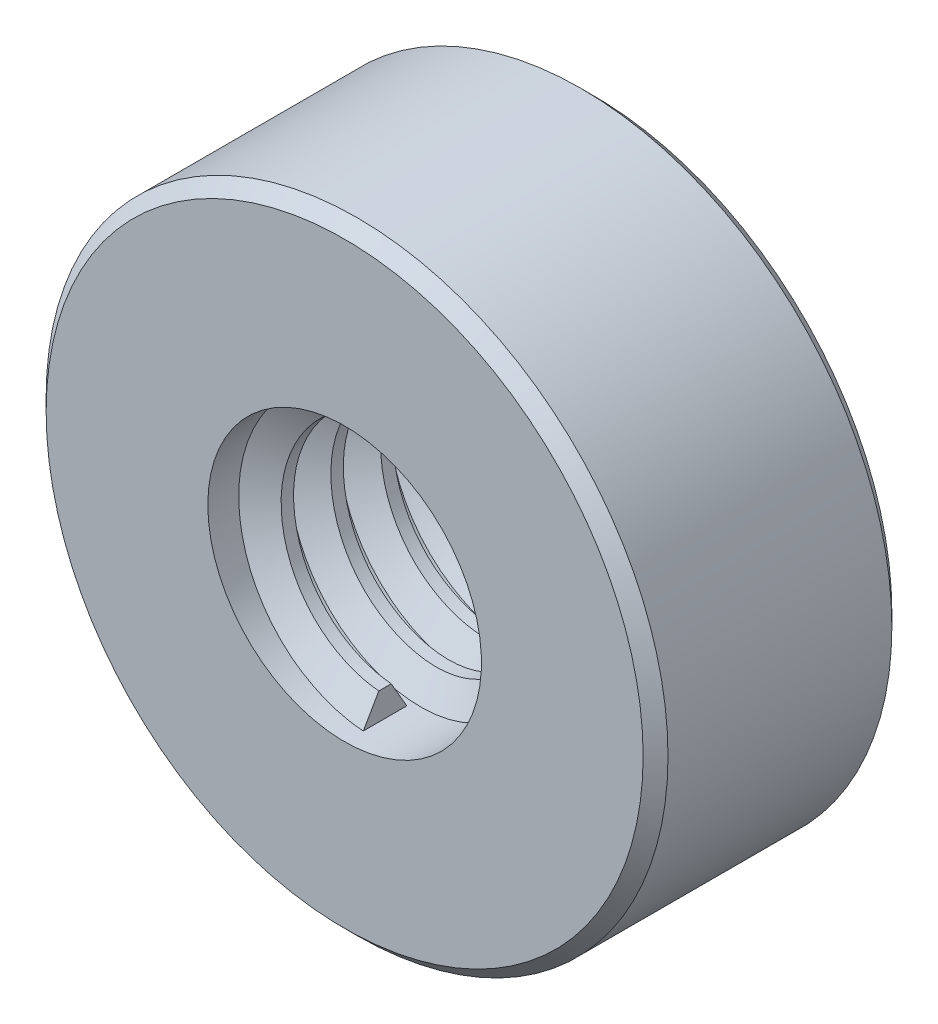
from build123d import *

# Parameters (mm, degrees)
SKETCH_1_R        = 2.5
EXTRUDE_1_DEPTH   = 2
CHAMFER_2_SIZE    = 0.1
HOLE_WIZARD_M21_D = 2.2
THREAD_1_PITCH    = 0.4
SCALE_1_SCALE     = 2


with BuildPart() as part:
    # Sketch 1 → Бобышка-Вытянуть1 (new body)
    with BuildSketch(Plane.XY):
        Circle(SKETCH_1_R)
    extrude(amount=EXTRUDE_1_DEPTH)

    # Фаска2
    chamfer_2_edges = [part.edges().sort_by_distance(p)[0] for p in [
        (-2.5, 0, 0),
        (-2.5, 0, 2),
    ]]
    chamfer(chamfer_2_edges, length=CHAMFER_2_SIZE)

    # Отверстие с зазором M21 (through all)
    with Locations(Plane(origin=(0, 0, 0), x_dir=(-1, 0, 0), z_dir=(0, 0, -1))):
        with Locations((0, 0)):
            Hole(HOLE_WIZARD_M21_D / 2)

    # Резьба1: the profile of Sketch 1 2 profile screwed along a right-hand helix of 3.75 turns, 6 arcs to a turn; built about Z, then put on its axis
    thread_1_z = Axis((0, 0, 0), (0, 0, 1))
    thread_1_corners = [(1.1003, 0, -0.000173205), (1.1003, 0, 0.350173204), (0.88349365, 0, 0.224999999), (0.88349365, 0, 0.124999999)]
    with BuildLine(mode=Mode.PRIVATE) as thread_1_profile:
        Line(thread_1_corners[0], thread_1_corners[1])
        Line(thread_1_corners[1], thread_1_corners[2])
        Line(thread_1_corners[2], thread_1_corners[3])
        Line(thread_1_corners[3], thread_1_corners[0])
    thread_1_cap = Face(thread_1_profile.wire())
    thread_1_turn_angles = [0, 30, 60, 90, 120, 150, 180, 210, 240, 270, 300, 330, 360]
    thread_1_turn_weights = [1, 0.8660254037844387, 1, 0.8660254037844387, 1, 0.8660254037844387, 1, 0.8660254037844387, 1, 0.8660254037844387, 1, 0.8660254037844387, 1]
    thread_1_turn_rails = [Edge.make_bspline([Vector(p[0], p[1], 0).rotate(thread_1_z, thread_1_turn_angles[k]) / thread_1_turn_weights[k] + Vector(0, 0, p[2] + THREAD_1_PITCH * thread_1_turn_angles[k] / 360) for k in range(13)], [0, 0, 0, 1, 1, 2, 2, 3, 3, 4, 4, 5, 5, 6, 6, 6], 2, thread_1_turn_weights) for p in thread_1_corners]
    thread_1_turn_sides = [Face.make_surface_from_curves(thread_1_turn_rails[p[0]], thread_1_turn_rails[p[1]]) for p in [(0, 1), (1, 2), (2, 3), (3, 0)]]
    thread_1_last_angles = [1080, 1110, 1140, 1170, 1200, 1230, 1260, 1290, 1320, 1335, 1350]
    thread_1_last_weights = [1, 0.8660254037844387, 1, 0.8660254037844387, 1, 0.8660254037844387, 1, 0.8660254037844387, 1, 0.9659258262890683, 1]
    thread_1_last_rails = [Edge.make_bspline([Vector(p[0], p[1], 0).rotate(thread_1_z, thread_1_last_angles[k]) / thread_1_last_weights[k] + Vector(0, 0, p[2] + THREAD_1_PITCH * thread_1_last_angles[k] / 360) for k in range(11)], [0, 0, 0, 1, 1, 2, 2, 3, 3, 4, 4, 5, 5, 5], 2, thread_1_last_weights) for p in thread_1_corners]
    thread_1_last_sides = [Face.make_surface_from_curves(thread_1_last_rails[p[0]], thread_1_last_rails[p[1]]) for p in [(0, 1), (1, 2), (2, 3), (3, 0)]]
    thread_1 = Plane(origin=(0, 0, 0), x_dir=(1, 0, 0), z_dir=(0, 0, 1)) * Solid(Shell([*[p.moved(Location((0, 0, THREAD_1_PITCH * i))) for i in range(3) for p in thread_1_turn_sides], *thread_1_last_sides, thread_1_cap, thread_1_cap.rotate(thread_1_z, 1350).moved(Location((0, 0, THREAD_1_PITCH * 1350 / 360)))]))
    add(thread_1)


with BuildPart() as part_1:
    # Масштаб1: scaled about (-0.001502253, 0.001928921, 0.997553273)
    add(part.part.scale(SCALE_1_SCALE).moved(Location((0.001502253, -0.001928921, -0.997553273))))


solid = part_1.part
